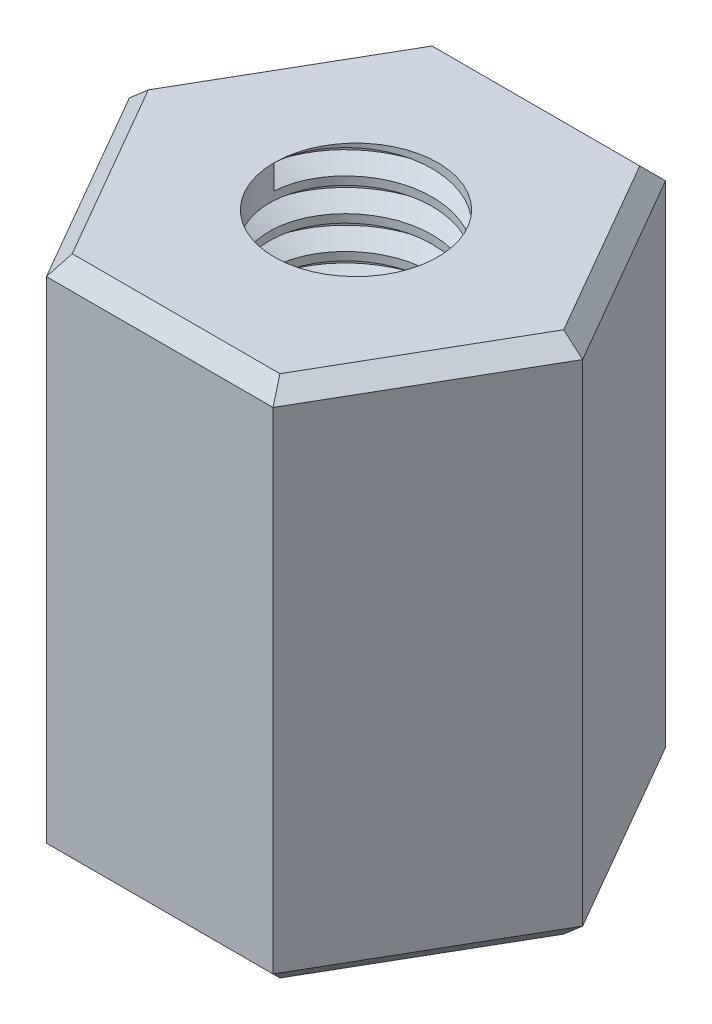
from build123d import *

# Parameters (mm, degrees)
SKETCH2_R           = 1.25
BOSS_EXTRUDE1_DEPTH = 8
THREAD1_PITCH       = 0.5
CHAMFER2_SIZE       = 0.25


with BuildPart() as part:
    # Sketch2 → Boss-Extrude1 (new body)
    with BuildSketch(Plane(origin=(0, 0, 0), x_dir=(1, 0, 0), z_dir=(0, 1, 0))):
        Polygon((3.464101615, 0), (1.732050808, 3), (-1.732050808, 3), (-3.464101615, 0), (-1.732050808, -3), (1.732050808, -3), align=None)
        with Locations(Location((0, 0, 0), (0, 0, 270))):
            Circle(SKETCH2_R, mode=Mode.SUBTRACT)
    extrude(amount=BOSS_EXTRUDE1_DEPTH)

    # Thread1: the profile of Thread Profile1 profile screwed along a right-hand helix of 16 turns, 6 arcs to a turn; built about Z, then put on its axis
    thread1_z = Axis((0, 0, 0), (0, 0, 1))
    thread1_corners = [(1.2497, 0, -0.000173205), (1.520632938, 0, 0.156249999), (1.520632937, 0, 0.218749999), (1.2497, 0, 0.375173204)]
    with BuildLine(mode=Mode.PRIVATE) as thread1_profile:
        Line(thread1_corners[0], thread1_corners[1])
        Line(thread1_corners[1], thread1_corners[2])
        Line(thread1_corners[2], thread1_corners[3])
        Line(thread1_corners[3], thread1_corners[0])
    thread1_cap = Face(thread1_profile.wire())
    thread1_turn_angles = [0, 30, 60, 90, 120, 150, 180, 210, 240, 270, 300, 330, 360]
    thread1_turn_weights = [1, 0.8660254037844387, 1, 0.8660254037844387, 1, 0.8660254037844387, 1, 0.8660254037844387, 1, 0.8660254037844387, 1, 0.8660254037844387, 1]
    thread1_turn_rails = [Edge.make_bspline([Vector(p[0], p[1], 0).rotate(thread1_z, thread1_turn_angles[k]) / thread1_turn_weights[k] + Vector(0, 0, p[2] + THREAD1_PITCH * thread1_turn_angles[k] / 360) for k in range(13)], [0, 0, 0, 1, 1, 2, 2, 3, 3, 4, 4, 5, 5, 6, 6, 6], 2, thread1_turn_weights) for p in thread1_corners]
    thread1_turn_sides = [Face.make_surface_from_curves(thread1_turn_rails[p[0]], thread1_turn_rails[p[1]]) for p in [(0, 1), (1, 2), (2, 3), (3, 0)]]
    thread1 = Plane(origin=(0, 8, 0), x_dir=(-1, 0, 0), z_dir=(0, -1, 0)) * Solid(Shell([*[p.moved(Location((0, 0, THREAD1_PITCH * i))) for i in range(16) for p in thread1_turn_sides], thread1_cap, thread1_cap.rotate(thread1_z, 5760).moved(Location((0, 0, THREAD1_PITCH * 5760 / 360)))]))
    add(thread1, mode=Mode.SUBTRACT)

    # Chamfer2
    chamfer2_edges = [part.edges().sort_by_distance(p)[0] for p in [
        (0, 8, -3),
        (-2.598076211, 8, -1.5),
        (-2.598076211, 8, 1.5),
        (0, 8, 3),
        (2.598076211, 8, 1.5),
        (0, 0, 3),
        (-2.598076211, 0, 1.5),
        (-2.598076211, 0, -1.5),
        (0, 0, -3),
        (2.598076211, 0, -1.5),
        (2.598076211, 0, 1.5),
        (2.598076211, 8, -1.5),
    ]]
    chamfer(chamfer2_edges, length=CHAMFER2_SIZE)


solid = part.part
